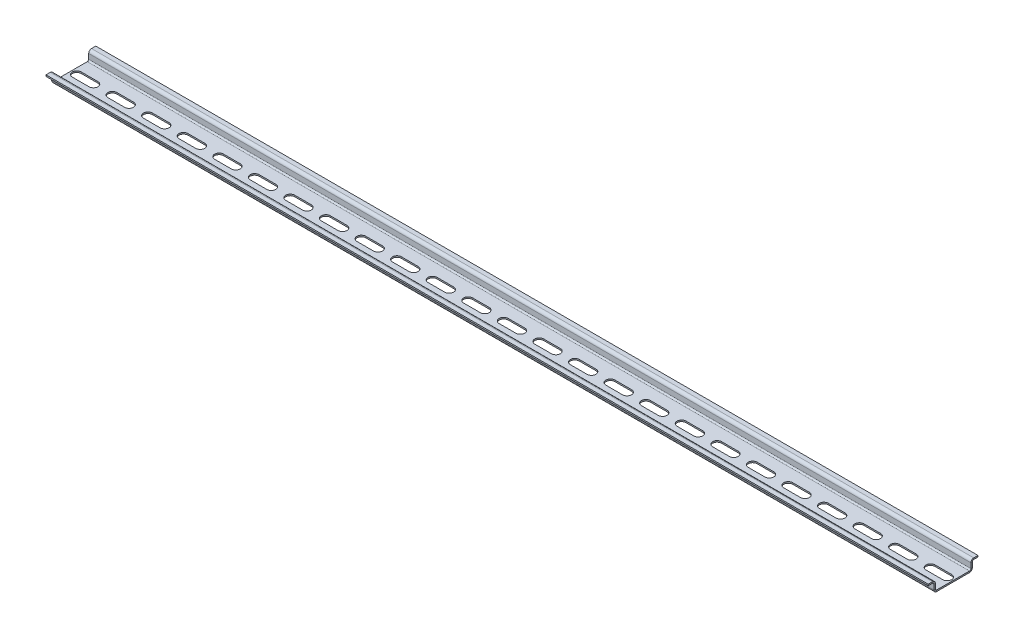
from build123d import *

# Parameters (mm, degrees)
BASE_FLANGE1_DEPTH         = 310
EXTRUDE_CUT_DEPTH          = 311.561588095
LINEAR_PATTERN_1_COUNT     = 13
LINEAR_PATTERN_1_PITCH     = 25
LINEAR_PATTERN_1_COL_COUNT = 13
LINEAR_PATTERN_1_COL_PITCH = 25


# Sheet-metal steps are written as plain solids
with BuildPart() as part:
    # Sketch2 → Base-Flange1 (new, symmetric)
    with BuildSketch(Plane(origin=(0, 0, 0), x_dir=(0, 0, -1), z_dir=(1, 0, 0))):
        with BuildLine():
            Line((-17.5, 6.5), (-14.5, 6.5))
            ThreePointArc((-14.5, 6.5), (-13.792893219, 6.207106781), (-13.5, 5.5))
            Line((-13.5, 5.5), (-13.5, 2))
            ThreePointArc((-13.5, 2), (-12.914213562, 0.585786438), (-11.5, 0))
            Line((-11.5, 0), (11.5, 0))
            ThreePointArc((11.5, 0), (12.914213562, 0.585786438), (13.5, 2))
            Line((13.5, 2), (13.5, 5.5))
            ThreePointArc((13.5, 5.5), (13.792893219, 6.207106781), (14.5, 6.5))
            Line((14.5, 6.5), (17.5, 6.5))
            Line((17.5, 6.5), (17.5, 7.5))
            Line((17.5, 7.5), (14.5, 7.5))
            ThreePointArc((14.5, 7.5), (13.085786438, 6.914213562), (12.5, 5.5))
            Line((12.5, 5.5), (12.5, 2))
            ThreePointArc((12.5, 2), (12.207106781, 1.292893219), (11.5, 1))
            Line((11.5, 1), (-11.5, 1))
            ThreePointArc((-11.5, 1), (-12.207106781, 1.292893219), (-12.5, 2))
            Line((-12.5, 2), (-12.5, 5.5))
            ThreePointArc((-12.5, 5.5), (-13.085786438, 6.914213562), (-14.5, 7.5))
            Line((-14.5, 7.5), (-17.5, 7.5))
            Line((-17.5, 7.5), (-17.5, 6.5))
        make_face()
    extrude(amount=BASE_FLANGE1_DEPTH, both=True)

    # Sketch1 → Extrude Cut (cut, through all)
    with BuildSketch(Plane(origin=(0, 1, 0), x_dir=(1, 0, 0), z_dir=(0, 1, 0))):
        with BuildLine():
            Line((-5.85, 3.15), (5.85, 3.15))
            ThreePointArc((5.85, 3.15), (9, 0), (5.85, -3.15))
            Line((5.85, -3.15), (-5.85, -3.15))
            ThreePointArc((-5.85, -3.15), (-9, 0), (-5.85, 3.15))
        make_face()
    extrude_cut = extrude(amount=-EXTRUDE_CUT_DEPTH, mode=Mode.SUBTRACT)

    # Linear Pattern 1: Extrude Cut ×13
    with Locations(*[(i * LINEAR_PATTERN_1_PITCH, 0, 0) for i in range(1, LINEAR_PATTERN_1_COUNT)]):
        add(extrude_cut, mode=Mode.SUBTRACT)

    # Linear Pattern 1 col: Extrude Cut ×13
    with Locations(*[(-i * LINEAR_PATTERN_1_COL_PITCH, 0, 0) for i in range(1, LINEAR_PATTERN_1_COL_COUNT)]):
        add(extrude_cut, mode=Mode.SUBTRACT)


solid = part.part
